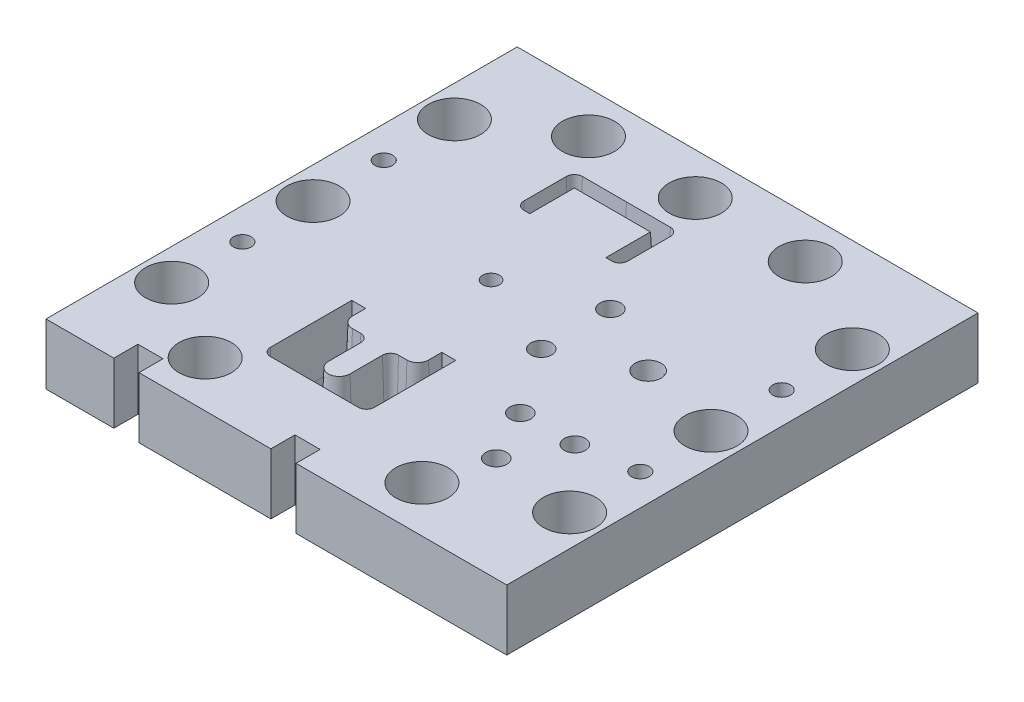
from build123d import *

# Parameters (mm, degrees)
SKETCH1_W                      = 220
SKETCH1_H                      = 225
BOSS_EXTRUDE1_DEPTH            = 29
CUT_EXTRUDE1_REACH             = 161.991
SKETCH2_R                      = 4
CUT_EXTRUDE2_REACH             = 161.991
SKETCH3_W                      = 12
SKETCH3_H                      = 11.5
LPATTERN1_COUNT                = 2
LPATTERN1_PITCH                = 75
SKETCH4_R                      = 8.5
CUT_EXTRUDE3_DEPTH             = 5
F_25_0_25_DIAMETER_HOLE3_D     = 25
F_25_0_25_DIAMETER_HOLE3_DEPTH = 20
F_25_0_25_DIAMETER_HOLE2_D     = 25
F_25_0_25_DIAMETER_HOLE2_DEPTH = 20
F_25_0_25_DIAMETER_HOLE1_D     = 25
F_25_0_25_DIAMETER_HOLE1_DEPTH = 20
CUT_EXTRUDE4_REACH             = 161.991
CUT_EXTRUDE6_REACH             = 161.991
F_10_0_10_DIAMETER_HOLE1_D     = 10
CUT_EXTRUDE7_REACH             = 161.991
SKETCH34_R                     = 5
M10_TAPPED_HOLE1_D             = 8.5


with BuildPart() as part:
    # Sketch1 → Boss-Extrude1 (new body)
    with BuildSketch(Plane(origin=(0, 0, 0), x_dir=(1, 0, 0), z_dir=(0, 1, 0))):
        Rectangle(SKETCH1_W, SKETCH1_H)
    extrude(amount=-BOSS_EXTRUDE1_DEPTH)

    # Sketch2 → Cut-Extrude1 (cut, up to next)
    with BuildSketch(Plane(origin=(0, 0, 0), x_dir=(1, 0, 0), z_dir=(0, 1, 0)), mode=Mode.PRIVATE) as cut_extrude1_sk1:
        with Locations((-19.87, 9.86)):
            Circle(SKETCH2_R)
    cut_extrude1_tool1 = extrude(cut_extrude1_sk1.sketch, amount=-CUT_EXTRUDE1_REACH, mode=Mode.PRIVATE) & part.part
    add(cut_extrude1_tool1.solids().sort_by_distance((-19.87, 0, -9.86))[0], mode=Mode.SUBTRACT)

    # Sketch3 → Cut-Extrude2 (cut, up to next)
    with BuildSketch(Plane.XZ.offset(29), mode=Mode.PRIVATE) as cut_extrude2_sk1:
        with Locations((3.38, 106.75)):
            Rectangle(SKETCH3_W, SKETCH3_H)
    cut_extrude2_tool1 = extrude(cut_extrude2_sk1.sketch, amount=-CUT_EXTRUDE2_REACH, mode=Mode.PRIVATE) & part.part
    cut_extrude2 = cut_extrude2_tool1.solids().sort_by_distance((3.38, -29, 106.75))[0]
    add(cut_extrude2, mode=Mode.SUBTRACT)

    # LPattern1: Cut-Extrude2 ×2
    with Locations(*[(-i * LPATTERN1_PITCH, 0, 0) for i in range(1, LPATTERN1_COUNT)]):
        add(cut_extrude2, mode=Mode.SUBTRACT)

    # Sketch4 → Cut-Extrude3 (cut)
    with BuildSketch(Plane.XZ.offset(29)):
        with Locations((-19.87, 100)):
            Circle(SKETCH4_R)
        with Locations((25, 100)):
            Circle(SKETCH4_R)
        with Locations((70, 100)):
            Circle(SKETCH4_R)
        with Locations((-19.87, -100)):
            Circle(SKETCH4_R)
        with Locations((25, -100)):
            Circle(SKETCH4_R)
        with Locations((70, -100)):
            Circle(SKETCH4_R)
        with Locations((-94.87, 100)):
            Circle(SKETCH4_R)
        with Locations((-94.87, -100)):
            Circle(SKETCH4_R)
    extrude(amount=-CUT_EXTRUDE3_DEPTH, mode=Mode.SUBTRACT)

    # Ø25.0 (25) Diameter Hole3
    with Locations(Plane(origin=(0, 0, 0), x_dir=(1, 0, 0), z_dir=(0, 1, 0))):
        with Locations((-95, -67.5), (-95, 0), (-95, 67.5), (95, 67.5), (95, 0), (95, -67.5)):
            Hole(F_25_0_25_DIAMETER_HOLE3_D / 2, depth=F_25_0_25_DIAMETER_HOLE3_DEPTH)

    # Ø25.0 (25) Diameter Hole2
    with Locations(Plane(origin=(0, 0, 0), x_dir=(1, 0, 0), z_dir=(0, 1, 0))):
        with Locations((-56, 92.5), (-5, 92.5), (47.5, 92.5)):
            Hole(F_25_0_25_DIAMETER_HOLE2_D / 2, depth=F_25_0_25_DIAMETER_HOLE2_DEPTH)

    # Ø25.0 (25) Diameter Hole1
    with Locations(Plane(origin=(0, 0, 0), x_dir=(1, 0, 0), z_dir=(0, 1, 0))):
        with Locations((47.5, -90.5), (-56, -90.5)):
            Hole(F_25_0_25_DIAMETER_HOLE1_D / 2, depth=F_25_0_25_DIAMETER_HOLE1_DEPTH)

    # Sketch24 → Cut-Extrude4 (cut, up to next)
    with BuildSketch(Plane(origin=(0, 0, 0), x_dir=(1, 0, 0), z_dir=(0, 1, 0)), mode=Mode.PRIVATE) as cut_extrude4_sk1:
        with BuildLine():
            Line((4.13, -32.64), (-0.87, -32.64))
            Line((-0.87, -32.64), (-0.87, -38.14))
            ThreePointArc((-0.87, -38.14), (-2.627359313, -42.382640687), (-6.87, -44.14))
            Line((-6.87, -44.14), (-10.87, -44.14))
            ThreePointArc((-10.87, -44.14), (-12.991320344, -45.018679656), (-13.87, -47.14))
            Line((-13.87, -47.14), (-13.87, -62.64))
            ThreePointArc((-13.87, -62.64), (-19.87, -68.64), (-25.87, -62.64))
            Line((-25.87, -62.64), (-25.87, -47.14))
            ThreePointArc((-25.87, -47.14), (-26.748679656, -45.018679656), (-28.87, -44.14))
            Line((-28.87, -44.14), (-32.87, -44.14))
            ThreePointArc((-32.87, -44.14), (-37.112640687, -42.382640687), (-38.87, -38.14))
            Line((-38.87, -38.14), (-38.87, -32.64))
            Line((-38.87, -32.64), (-43.87, -32.64))
            Line((-43.87, -32.64), (-43.87, -70.64))
            ThreePointArc((-43.87, -70.64), (-42.991320344, -72.761320344), (-40.87, -73.64))
            Line((-40.87, -73.64), (1.13, -73.64))
            ThreePointArc((1.13, -73.64), (3.251320344, -72.761320344), (4.13, -70.64))
            Line((4.13, -70.64), (4.13, -32.64))
        make_face()
    cut_extrude4_tool1 = extrude(cut_extrude4_sk1.sketch, amount=-CUT_EXTRUDE4_REACH, mode=Mode.PRIVATE) & part.part
    add(cut_extrude4_tool1.solids().sort_by_distance((-42.544946, 0, 72.314946))[0], mode=Mode.SUBTRACT)

    # Sketch29 → Cut-Extrude6 (cut, up to next)
    with BuildSketch(Plane.XZ.offset(29), mode=Mode.PRIVATE) as cut_extrude6_sk1:
        with BuildLine():
            Line((-0.87, -47.36), (1.13, -47.36))
            ThreePointArc((1.13, -47.36), (3.251320344, -48.238679656), (4.13, -50.36))
            Line((4.13, -50.36), (4.13, -70.64))
            ThreePointArc((4.13, -70.64), (3.251320344, -72.761320344), (1.13, -73.64))
            Line((1.13, -73.64), (-40.87, -73.64))
            ThreePointArc((-40.87, -73.64), (-42.991320344, -72.761320344), (-43.87, -70.64))
            Line((-43.87, -70.64), (-43.87, -50.36))
            ThreePointArc((-43.87, -50.36), (-42.991320344, -48.238679656), (-40.87, -47.36))
            Line((-40.87, -47.36), (-38.87, -47.36))
            Line((-38.87, -47.36), (-38.87, -68.64))
            Line((-38.87, -68.64), (-0.87, -68.64))
            Line((-0.87, -68.64), (-0.87, -47.36))
        make_face()
    cut_extrude6_tool1 = extrude(cut_extrude6_sk1.sketch, amount=-CUT_EXTRUDE6_REACH, mode=Mode.PRIVATE) & part.part
    add(cut_extrude6_tool1.solids().sort_by_distance((0.13, -29, -47.907233))[0], mode=Mode.SUBTRACT)

    # Ø10.0 (10) Diameter Hole1 (through all)
    with Locations(Plane(origin=(0, 0, 0), x_dir=(1, 0, 0), z_dir=(0, 1, 0))):
        with Locations((55.13, -62.64), (68.13, -38.14), (42.13, -38.14), (20.63, 26.36), (20.63, -6.64)):
            Hole(F_10_0_10_DIAMETER_HOLE1_D / 2)

    # Sketch34 → Cut-Extrude7 (cut, up to next)
    with BuildSketch(Plane(origin=(0, 0, 0), x_dir=(1, 0, 0), z_dir=(0, 1, 0)), mode=Mode.PRIVATE) as cut_extrude7_sk1:
        with Locations((55.13, 9.86)):
            Circle(SKETCH34_R)
    cut_extrude7_tool1 = extrude(cut_extrude7_sk1.sketch, amount=-CUT_EXTRUDE7_REACH, mode=Mode.PRIVATE) & part.part
    add(cut_extrude7_tool1.solids().sort_by_distance((55.13, 0, -9.86))[0], mode=Mode.SUBTRACT)

    # Cut-Sweep1: sweep along a curve in space
    with BuildLine() as cut_sweep1_path:
        ThreePointArc((55.13, 0, -4.86), (58.665533906, 0, -6.324466094), (60.13, 0, -9.86))
        ThreePointArc((60.13, 0, -9.86), (58.665533906, 0, -13.395533906), (55.13, 0, -14.86))
        ThreePointArc((55.13, 0, -14.86), (51.594466094, 0, -13.395533906), (50.13, 0, -9.86))
        ThreePointArc((50.13, 0, -9.86), (51.594466094, 0, -6.324466094), (55.13, 0, -4.86))
    # Sketch35 → Cut-Sweep1 (sweep, cut)
    with BuildSketch(Plane.XY.offset(-9.86)):
        Polygon((60.13, -23), (61.335378924, 0), (60.13, 0), align=None)
    sweep(path=cut_sweep1_path.line, mode=Mode.SUBTRACT)

    # M10 Tapped Hole1 (through all)
    with Locations(Plane(origin=(0, 0, 0), x_dir=(1, 0, 0), z_dir=(0, 1, 0))):
        with Locations((-95, 33.75), (-95, -33.75), (95, -33.75), (95, 33.75)):
            Hole(M10_TAPPED_HOLE1_D / 2)

    # Cut-Sweep2: sweep along a path in Sketch49
    with BuildLine(Plane.XZ.offset(29)) as cut_sweep2_path:
        Line((-38.87, 38.14), (-38.87, 32.64))
        Line((-38.87, 32.64), (-43.87, 32.64))
        Line((-43.87, 32.64), (-43.87, 70.64))
        ThreePointArc((-43.87, 70.64), (-42.991320344, 72.761320344), (-40.87, 73.64))
        Line((-40.87, 73.64), (1.13, 73.64))
        ThreePointArc((1.13, 73.64), (3.251320344, 72.761320344), (4.13, 70.64))
        Line((4.13, 70.64), (4.13, 32.64))
        Line((4.13, 32.64), (-0.87, 32.64))
        Line((-0.87, 32.64), (-0.87, 38.14))
        ThreePointArc((-0.87, 38.14), (-2.627359313, 42.382640687), (-6.87, 44.14))
        Line((-6.87, 44.14), (-10.87, 44.14))
        ThreePointArc((-10.87, 44.14), (-12.991320344, 45.018679656), (-13.87, 47.14))
        Line((-13.87, 47.14), (-13.87, 62.64))
        ThreePointArc((-13.87, 62.64), (-19.87, 68.64), (-25.87, 62.64))
        Line((-25.87, 62.64), (-25.87, 47.14))
        ThreePointArc((-25.87, 47.14), (-26.748679656, 45.018679656), (-28.87, 44.14))
        Line((-28.87, 44.14), (-32.87, 44.14))
        ThreePointArc((-32.87, 44.14), (-37.112640687, 42.382640687), (-38.87, 38.14))
    # Sketch48 → Cut-Sweep2 (sweep, cut)
    with BuildSketch(Plane(origin=(-19.87, 0, 0), x_dir=(0, 0, -1), z_dir=(1, 0, 0))):
        Polygon((-73.64, -24), (-74.478098468, 0), (-73.64, 0), align=None)
    sweep(path=cut_sweep2_path.line, transition=Transition.RIGHT, mode=Mode.SUBTRACT)

    # Cut-Sweep3: sweep along a path in Sketch51
    with BuildLine(Plane.XZ.offset(29)) as cut_sweep3_path:
        Line((-0.87, -68.64), (-38.87, -68.64))
        Line((-38.87, -68.64), (-38.87, -47.36))
        Line((-38.87, -47.36), (-40.87, -47.36))
        ThreePointArc((-40.87, -47.36), (-42.991320344, -48.238679656), (-43.87, -50.36))
        Line((-43.87, -50.36), (-43.87, -70.64))
        ThreePointArc((-43.87, -70.64), (-42.991320344, -72.761320344), (-40.87, -73.64))
        Line((-40.87, -73.64), (1.13, -73.64))
        ThreePointArc((1.13, -73.64), (3.251320344, -72.761320344), (4.13, -70.64))
        Line((4.13, -70.64), (4.13, -50.36))
        ThreePointArc((4.13, -50.36), (3.251320344, -48.238679656), (1.13, -47.36))
        Line((1.13, -47.36), (-0.87, -47.36))
        Line((-0.87, -47.36), (-0.87, -68.64))
    # Sketch50 → Cut-Sweep3 (sweep, cut)
    with BuildSketch(Plane(origin=(-19.87, 0, 0), x_dir=(0, 0, -1), z_dir=(1, 0, 0))):
        Polygon((73.64, -24), (73.64, 0), (74.478098468, 0), align=None)
    sweep(path=cut_sweep3_path.line, transition=Transition.RIGHT, mode=Mode.SUBTRACT)


solid = part.part
